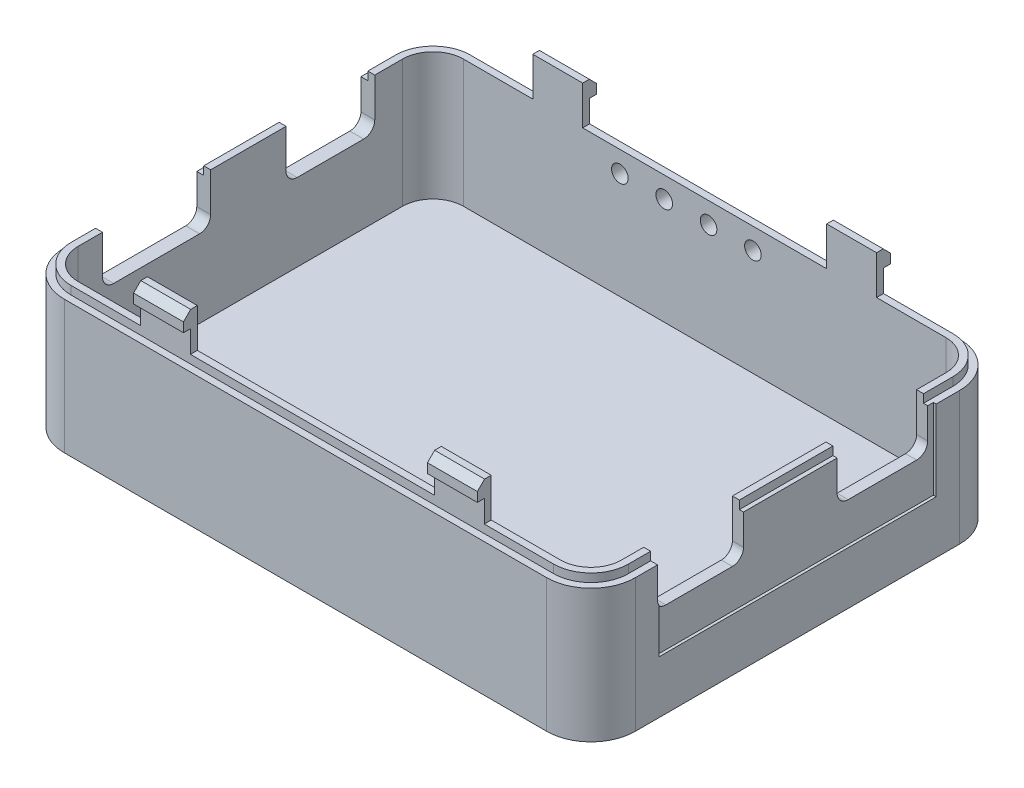
from build123d import *

# Parameters (mm, degrees)
EXTRUDE_1_DEPTH            = 25.5
CUT_EXTRUDE_1_DEPTH        = 23
CUT_EXTRUDE_START          = -1.5
CUT_EXTRUDE_2_DEPTH        = 1.5
SKETCH_3_W                 = 9
SKETCH_3_H                 = 1.25
EXTRUDE_2_DEPTH            = 7
SKETCH_4_W                 = 9
SKETCH_4_H                 = 3
EXTRUDE_3_DEPTH            = 1.25
CHAMFER_1_SIZE             = 1.3
CHAMFER_1_OF_MIRROR_1_SIZE = 1.3
MIRROR_START               = -31
MIRROR_4_DEPTH             = 9
MIRROR_START_2             = 22
MIRROR_4_2_DEPTH           = 9
SKETCH_5_W                 = 75
SKETCH_5_H                 = 50
CUT_EXTRUDE_3_DEPTH        = 0.5
CUT_EXTRUDE_4_DEPTH        = 115.248905903
CUT_EXTRUDE_4_DEPTH_BACK   = 0.5
SKETCH_6_W                 = 50
SKETCH_6_H                 = 14.5
CUT_EXTRUDE_5_REACH        = 98.222
SKETCH_7_R                 = 1.5
CUT_EXTRUDE_6_REACH        = 116.249
CUT_EXTRUDE_7_REACH        = 116.249


# Read off the part's stored shape, not the designer's step: Зеркальное отражение4
with BuildPart() as part:
    # Эскиз1 → Бобышка-Вытянуть1 (new body)
    with BuildSketch(Plane(origin=(0, 0, 0), x_dir=(1, 0, 0), z_dir=(0, 1, 0))):
        with BuildLine():
            Line((-43.5, 37.25), (43.5, 37.25))
            ThreePointArc((43.5, 37.25), (49.156854249, 34.906854249), (51.5, 29.25))
            Line((51.5, 29.25), (51.5, -29.25))
            ThreePointArc((51.5, -29.25), (49.156854249, -34.906854249), (43.5, -37.25))
            Line((43.5, -37.25), (-43.5, -37.25))
            ThreePointArc((-43.5, -37.25), (-49.156854249, -34.906854249), (-51.5, -29.25))
            Line((-51.5, -29.25), (-51.5, 29.25))
            ThreePointArc((-51.5, 29.25), (-49.156854249, 34.906854249), (-43.5, 37.25))
        make_face()
    extrude(amount=EXTRUDE_1_DEPTH)

    # Эскиз2 → Вырез-Вытянуть1 (cut)
    with BuildSketch(Plane(origin=(0, 25.5, 0), x_dir=(1, 0, 0), z_dir=(0, 1, 0))):
        with BuildLine():
            Line((-49, 29.25), (-49, -29.25))
            ThreePointArc((-49, -29.25), (-47.389087297, -33.139087297), (-43.5, -34.75))
            Line((-43.5, -34.75), (43.5, -34.75))
            ThreePointArc((43.5, -34.75), (47.389087297, -33.139087297), (49, -29.25))
            Line((49, -29.25), (49, 29.25))
            ThreePointArc((49, 29.25), (47.389087297, 33.139087297), (43.5, 34.75))
            Line((43.5, 34.75), (-43.5, 34.75))
            ThreePointArc((-43.5, 34.75), (-47.389087297, 33.139087297), (-49, 29.25))
        make_face()
    extrude(amount=-CUT_EXTRUDE_1_DEPTH, mode=Mode.SUBTRACT)

    # Эскиз2<3> → Вырез-Вытянуть2 (cut)
    with BuildSketch(Plane(origin=(0, 25.5, 0), x_dir=(1, 0, 0), z_dir=(0, 1, 0)).offset(CUT_EXTRUDE_START)):
        with BuildLine():
            Line((51.5, -29.25), (51.5, 29.25))
            ThreePointArc((51.5, 29.25), (49.156854249, 34.906854249), (43.5, 37.25))
            Line((43.5, 37.25), (-43.5, 37.25))
            ThreePointArc((-43.5, 37.25), (-49.156854249, 34.906854249), (-51.5, 29.25))
            Line((-51.5, 29.25), (-51.5, -29.25))
            ThreePointArc((-51.5, -29.25), (-49.156854249, -34.906854249), (-43.5, -37.25))
            Line((-43.5, -37.25), (43.5, -37.25))
            ThreePointArc((43.5, -37.25), (49.156854249, -34.906854249), (51.5, -29.25))
        make_face()
        with BuildLine():
            ThreePointArc((43.5, -36), (48.272970773, -34.022970773), (50.25, -29.25))
            Line((50.25, -29.25), (50.25, 29.25))
            ThreePointArc((50.25, 29.25), (48.272970773, 34.022970773), (43.5, 36))
            Line((43.5, 36), (-43.5, 36))
            ThreePointArc((-43.5, 36), (-48.272970773, 34.022970773), (-50.25, 29.25))
            Line((-50.25, 29.25), (-50.25, -29.25))
            ThreePointArc((-50.25, -29.25), (-48.272970773, -34.022970773), (-43.5, -36))
            Line((-43.5, -36), (43.5, -36))
        make_face(mode=Mode.SUBTRACT)
    extrude(amount=CUT_EXTRUDE_2_DEPTH, mode=Mode.SUBTRACT)

    # Эскиз3 → Бобышка-Вытянуть2 (add)
    with BuildSketch(Plane(origin=(0, 25.5, 0), x_dir=(1, 0, 0), z_dir=(0, 1, 0))):
        with Locations((-26.5, -35.375)):
            Rectangle(SKETCH_3_W, SKETCH_3_H)
    extrude_2 = extrude(amount=EXTRUDE_2_DEPTH)

    # Эскиз4 → Бобышка-Вытянуть3 (add, through all)
    with BuildSketch(Plane.XY.offset(36)):
        with Locations((-26.5, 31)):
            Rectangle(SKETCH_4_W, SKETCH_4_H)
    extrude_3 = extrude(amount=EXTRUDE_3_DEPTH)

    # Фаска1
    chamfer_1_edges = [part.edges().sort_by_distance(p)[0] for p in [
        (-26.5, 32.5, 37.25),
    ]]
    chamfer(chamfer_1_edges, length=CHAMFER_1_SIZE)

    # Зеркальное отражение1: Бобышка-Вытянуть2, Бобышка-Вытянуть3 across plane
    add(extrude_2.mirror(Plane(origin=(0, 0, 0), x_dir=(0, 0, 1), z_dir=(1, 0, 0))))
    add(extrude_3.mirror(Plane(origin=(0, 0, 0), x_dir=(0, 0, 1), z_dir=(1, 0, 0))))

    # Фаска1 of Зеркальное отражение1
    chamfer_1_of_mirror_1_edges = [part.edges().sort_by_distance(p)[0] for p in [
        (26.5, 32.5, 37.25),
    ]]
    chamfer(chamfer_1_of_mirror_1_edges, length=CHAMFER_1_OF_MIRROR_1_SIZE)

    # Зеркальное отражение4 outline → Зеркальное отражение4 (add)
    with BuildSketch(Plane.YZ.offset(MIRROR_START)):
        Polygon((25.5, -34.75), (25.5, -36), (29.5, -36), (29.5, -37.25), (31.2, -37.25), (32.5, -35.95), (32.5, -34.75), align=None)
    extrude(amount=MIRROR_4_DEPTH)

    # Mirror 4 2 outline → Mirror 4 2 (add)
    with BuildSketch(Plane.YZ.offset(MIRROR_START_2)):
        Polygon((25.5, -34.75), (25.5, -36), (29.5, -36), (29.5, -37.25), (31.2, -37.25), (32.5, -35.95), (32.5, -34.75), align=None)
    extrude(amount=MIRROR_4_2_DEPTH)

    # Эскиз5 → Вырез-Вытянуть3 (cut)
    with BuildSketch(Plane.XZ):
        Rectangle(SKETCH_5_W, SKETCH_5_H)
    extrude(amount=-CUT_EXTRUDE_3_DEPTH, mode=Mode.SUBTRACT)

    # Эскиз6 → Вырез-Вытянуть4 (cut, two sides: drawn at the far end of the back side and taken through both)
    with BuildSketch(Plane(origin=(51.5, 0, 0), x_dir=(0, 0, -1), z_dir=(1, 0, 0)).offset(-CUT_EXTRUDE_4_DEPTH_BACK)):
        with Locations((0, 16.75)):
            Rectangle(SKETCH_6_W, SKETCH_6_H)
    extrude(amount=CUT_EXTRUDE_4_DEPTH + CUT_EXTRUDE_4_DEPTH_BACK, mode=Mode.SUBTRACT)

    # Эскиз7 → Вырез-Вытянуть5 (cut, up to next)
    with BuildSketch(Plane(origin=(0, 0, -37.25), x_dir=(-1, 0, 0), z_dir=(0, 0, -1)), mode=Mode.PRIVATE) as cut_extrude_5_sk1:
        with Locations((15.3, 21.7)):
            Circle(SKETCH_7_R)
    cut_extrude_5_tool1 = extrude(cut_extrude_5_sk1.sketch, amount=-CUT_EXTRUDE_5_REACH, mode=Mode.PRIVATE) & part.part
    # Эскиз7 → Вырез-Вытянуть5 (cut, up to next)
    with BuildSketch(Plane(origin=(0, 0, -37.25), x_dir=(-1, 0, 0), z_dir=(0, 0, -1)), mode=Mode.PRIVATE) as cut_extrude_5_sk2:
        with Locations((7.3, 21.7)):
            Circle(SKETCH_7_R)
    cut_extrude_5_tool2 = extrude(cut_extrude_5_sk2.sketch, amount=-CUT_EXTRUDE_5_REACH, mode=Mode.PRIVATE) & part.part
    # Эскиз7 → Вырез-Вытянуть5 (cut, up to next)
    with BuildSketch(Plane(origin=(0, 0, -37.25), x_dir=(-1, 0, 0), z_dir=(0, 0, -1)), mode=Mode.PRIVATE) as cut_extrude_5_sk3:
        with Locations((-0.7, 21.7)):
            Circle(SKETCH_7_R)
    cut_extrude_5_tool3 = extrude(cut_extrude_5_sk3.sketch, amount=-CUT_EXTRUDE_5_REACH, mode=Mode.PRIVATE) & part.part
    # Эскиз7 → Вырез-Вытянуть5 (cut, up to next)
    with BuildSketch(Plane(origin=(0, 0, -37.25), x_dir=(-1, 0, 0), z_dir=(0, 0, -1)), mode=Mode.PRIVATE) as cut_extrude_5_sk4:
        with Locations((-8.7, 21.7)):
            Circle(SKETCH_7_R)
    cut_extrude_5_tool4 = extrude(cut_extrude_5_sk4.sketch, amount=-CUT_EXTRUDE_5_REACH, mode=Mode.PRIVATE) & part.part
    add(cut_extrude_5_tool1.solids().sort_by_distance((-15.3, 21.7, -37.25))[0], mode=Mode.SUBTRACT)
    add(cut_extrude_5_tool2.solids().sort_by_distance((-7.3, 21.7, -37.25))[0], mode=Mode.SUBTRACT)
    add(cut_extrude_5_tool3.solids().sort_by_distance((0.7, 21.7, -37.25))[0], mode=Mode.SUBTRACT)
    add(cut_extrude_5_tool4.solids().sort_by_distance((8.7, 21.7, -37.25))[0], mode=Mode.SUBTRACT)

    # Эскиз8 → Вырез-Вытянуть6 (cut, up to next)
    with BuildSketch(Plane.ZY.offset(51.5), mode=Mode.PRIVATE) as cut_extrude_6_sk1:
        with BuildLine():
            Line((-10.25, 16.5), (-22.25, 16.5))
            ThreePointArc((-22.25, 16.5), (-23.664213562, 17.085786438), (-24.25, 18.5))
            Line((-24.25, 18.5), (-24.25, 25.5))
            Line((-24.25, 25.5), (-8.25, 25.5))
            Line((-8.25, 25.5), (-8.25, 18.5))
            ThreePointArc((-8.25, 18.5), (-8.835786438, 17.085786438), (-10.25, 16.5))
        make_face()
    cut_extrude_6_tool1 = extrude(cut_extrude_6_sk1.sketch, amount=-CUT_EXTRUDE_6_REACH, mode=Mode.PRIVATE) & part.part
    # Эскиз8 → Вырез-Вытянуть6 (cut, up to next)
    with BuildSketch(Plane.ZY.offset(51.5), mode=Mode.PRIVATE) as cut_extrude_6_sk2:
        with BuildLine():
            Line((22.85, 16.5), (7.35, 16.5))
            ThreePointArc((7.35, 16.5), (5.935786438, 17.085786438), (5.35, 18.5))
            Line((5.35, 18.5), (5.35, 25.5))
            Line((5.35, 25.5), (24.85, 25.5))
            Line((24.85, 25.5), (24.85, 18.5))
            ThreePointArc((24.85, 18.5), (24.264213562, 17.085786438), (22.85, 16.5))
        make_face()
    cut_extrude_6_tool2 = extrude(cut_extrude_6_sk2.sketch, amount=-CUT_EXTRUDE_6_REACH, mode=Mode.PRIVATE) & part.part
    add(cut_extrude_6_tool1.solids().sort_by_distance((-51.5, 21.048907, -16.25))[0], mode=Mode.SUBTRACT)
    add(cut_extrude_6_tool2.solids().sort_by_distance((-51.5, 21.040042, 15.1))[0], mode=Mode.SUBTRACT)

    # Эскиз9 → Вырез-Вытянуть7 (cut, up to next)
    with BuildSketch(Plane(origin=(51.5, 0, 0), x_dir=(0, 0, -1), z_dir=(1, 0, 0)), mode=Mode.PRIVATE) as cut_extrude_7_sk1:
        with BuildLine():
            Line((-25.25, 25.5), (-9.25, 25.5))
            Line((-9.25, 25.5), (-9.25, 18.5))
            ThreePointArc((-9.25, 18.5), (-9.835786438, 17.085786438), (-11.25, 16.5))
            Line((-11.25, 16.5), (-23.25, 16.5))
            ThreePointArc((-23.25, 16.5), (-24.664213562, 17.085786438), (-25.25, 18.5))
            Line((-25.25, 18.5), (-25.25, 25.5))
        make_face()
    cut_extrude_7_tool1 = extrude(cut_extrude_7_sk1.sketch, amount=-CUT_EXTRUDE_7_REACH, mode=Mode.PRIVATE) & part.part
    # Эскиз9 → Вырез-Вытянуть7 (cut, up to next)
    with BuildSketch(Plane(origin=(51.5, 0, 0), x_dir=(0, 0, -1), z_dir=(1, 0, 0)), mode=Mode.PRIVATE) as cut_extrude_7_sk2:
        with BuildLine():
            Line((7.629289035, 25.5), (23.970741735, 25.5))
            Line((23.970741735, 25.5), (23.970741735, 18.5))
            ThreePointArc((23.970741735, 18.5), (23.384955297, 17.085786438), (21.970741735, 16.5))
            Line((21.970741735, 16.5), (9.629289035, 16.5))
            ThreePointArc((9.629289035, 16.5), (8.215075473, 17.085786438), (7.629289035, 18.5))
            Line((7.629289035, 18.5), (7.629289035, 25.5))
        make_face()
    cut_extrude_7_tool2 = extrude(cut_extrude_7_sk2.sketch, amount=-CUT_EXTRUDE_7_REACH, mode=Mode.PRIVATE) & part.part
    add(cut_extrude_7_tool1.solids().sort_by_distance((51.5, 21.048907, 17.25))[0], mode=Mode.SUBTRACT)
    add(cut_extrude_7_tool2.solids().sort_by_distance((51.5, 21.047873, -15.800015))[0], mode=Mode.SUBTRACT)


solid = part.part
